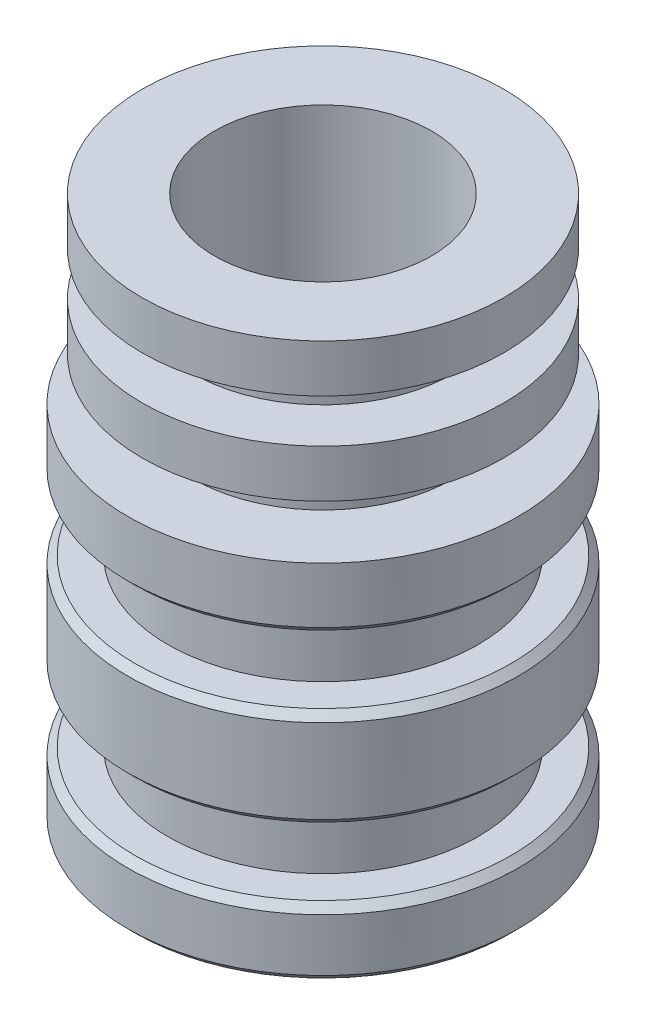
from build123d import *

# Parameters (mm, degrees)
ESQUISSE4_R             = 2
ENL_V_MAT_EXTRU_3_DEPTH = 43.347845282
CHANFREIN4_SIZE         = 0.5
CHANFREIN3_SIZE         = 0.5


with BuildPart() as part:
    # Esquisse1 → Révolution1 (revolve)
    with BuildSketch(Plane.XY):
        Polygon((0, 0), (-13.5, 0), (-13.5, 4.64), (-10.73, 4.64), (-10.73, 9.34), (-13.5, 9.34), (-13.5, 16.14), (-10.73, 16.14), (-10.73, 20.84), (-13.5, 20.84), (-13.5, 25.2), (-12.5, 25.2), (-9, 25.2), (-9, 28.2), (-12.5, 28.2), (-12.5, 31.5), (-9, 31.5), (-9, 34.5), (-12.5, 34.5), (-12.5, 37.8), (-7.5, 37.8), (-7.5, 20.84), (-7.5, 8), (0, 8), align=None)
    revolve(axis=Axis((0, -29.115408637, 0), (0, 1, 0)))

    # Esquisse4 → Enlèv. mat.-Extru.3 (cut, through all)
    with BuildSketch(Plane.XZ):
        Circle(ESQUISSE4_R)
    extrude(amount=-ENL_V_MAT_EXTRU_3_DEPTH, mode=Mode.SUBTRACT)

    # Chanfrein4
    chanfrein4_edges = [part.edges().sort_by_distance(p)[0] for p in [
        (-2, 8, 0),
        (-2, 0, 0),
    ]]
    chamfer(chanfrein4_edges, length=CHANFREIN4_SIZE)

    # Chanfrein3
    chanfrein3_edges = [part.edges().sort_by_distance(p)[0] for p in [
        (13.5, 0, 0),
        (13.5, 20.84, 0),
        (13.5, 16.14, 0),
        (13.5, 9.34, 0),
        (13.5, 4.64, 0),
    ]]
    chamfer(chanfrein3_edges, length=CHANFREIN3_SIZE)


solid = part.part
